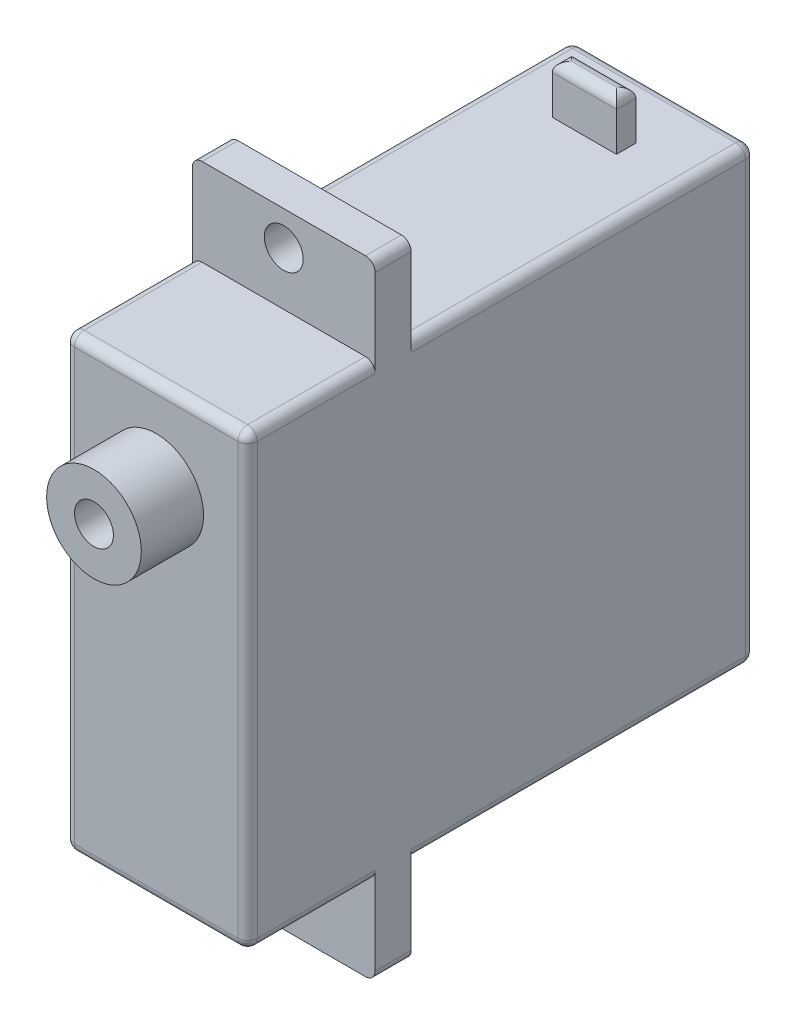
from build123d import *

# Parameters (mm, degrees)
BOSS_EXTRUDE1_DEPTH = 9.4
FILLET1_R           = 0.5
FILLET2_R           = 0.5
SKETCH2_R           = 1
CUT_EXTRUDE1_DEPTH  = 27.98026362
SKETCH3_W           = 3.3
SKETCH3_H           = 1
BOSS_EXTRUDE2_DEPTH = 2.5
FILLET3_R           = 0.5
SKETCH4_R           = 2.435
SKETCH4_R_2         = 1
BOSS_EXTRUDE3_DEPTH = 3.2


with BuildPart() as part:
    # Sketch1 → Boss-Extrude1 (new body)
    with BuildSketch(Plane(origin=(0, 0, 0), x_dir=(0, 0, -1), z_dir=(1, 0, 0))):
        Polygon((-4.64, 11.565), (13.05, 11.565), (13.05, -11.565), (-4.64, -11.565), (-4.64, -16.055), (-6.49, -16.055), (-6.49, -11.565), (-13.05, -11.565), (-13.05, 11.565), (-6.49, 11.565), (-6.49, 16.055), (-4.64, 16.055), align=None)
    extrude(amount=BOSS_EXTRUDE1_DEPTH)

    # Fillet1
    fillet1_edges = [part.edges().sort_by_distance(p)[0] for p in [
        (0, -16.055, 5.565),
        (0, 16.055, 5.565),
        (9.4, 16.055, 5.565),
        (9.4, -16.055, 5.565),
    ]]
    fillet(fillet1_edges, radius=FILLET1_R)

    # Fillet2
    fillet2_edges = [part.edges().sort_by_distance(p)[0] for p in [
        (0, -11.565, -4.205),
        (0, -11.565, 9.77),
        (0, 0, 13.05),
        (0, 11.565, 9.77),
        (0, 11.565, -4.205),
        (0, 0, -13.05),
        (4.7, -11.565, -13.05),
        (4.7, -11.565, 13.05),
        (4.7, 11.565, 13.05),
        (4.7, 11.565, -13.05),
        (9.4, 11.565, 9.77),
        (9.4, 0, 13.05),
        (9.4, -11.565, 9.77),
        (9.4, -11.565, -4.205),
        (9.4, 0, -13.05),
        (9.4, 11.565, -4.205),
    ]]
    fillet(fillet2_edges, radius=FILLET2_R)

    # Sketch2 → Cut-Extrude1 (cut, through all)
    with BuildSketch(Plane.XY.offset(6.49)):
        with Locations((4.7, -14.3)):
            Circle(SKETCH2_R)
        with Locations((4.7, 14.3)):
            Circle(SKETCH2_R)
    extrude(amount=-CUT_EXTRUDE1_DEPTH, mode=Mode.SUBTRACT)

    # Sketch3 → Boss-Extrude2 (add)
    with BuildSketch(Plane(origin=(0, 11.565, 0), x_dir=(1, 0, 0), z_dir=(0, 1, 0))):
        with Locations((4.7, 9.470007)):
            Rectangle(SKETCH3_W, SKETCH3_H)
    extrude(amount=BOSS_EXTRUDE2_DEPTH)

    # Fillet3
    fillet3_edges = [part.edges().sort_by_distance(p)[0] for p in [
        (3.05, 14.065, -9.470007),
        (4.7, 14.065, -8.970007),
        (6.35, 14.065, -9.470007),
        (4.7, 14.065, -9.970007),
    ]]
    fillet(fillet3_edges, radius=FILLET3_R - 0.0001)  # a hair under: the kernel refuses the full size

    # Sketch4 → Boss-Extrude3 (add)
    with BuildSketch(Plane.XY.offset(13.05)):
        with Locations(Location((4.7, 6.88, 0), (0, 0, 180))):
            Circle(SKETCH4_R)
        with Locations((4.7, 6.88)):
            Circle(SKETCH4_R_2, mode=Mode.SUBTRACT)
    extrude(amount=BOSS_EXTRUDE3_DEPTH)


solid = part.part
